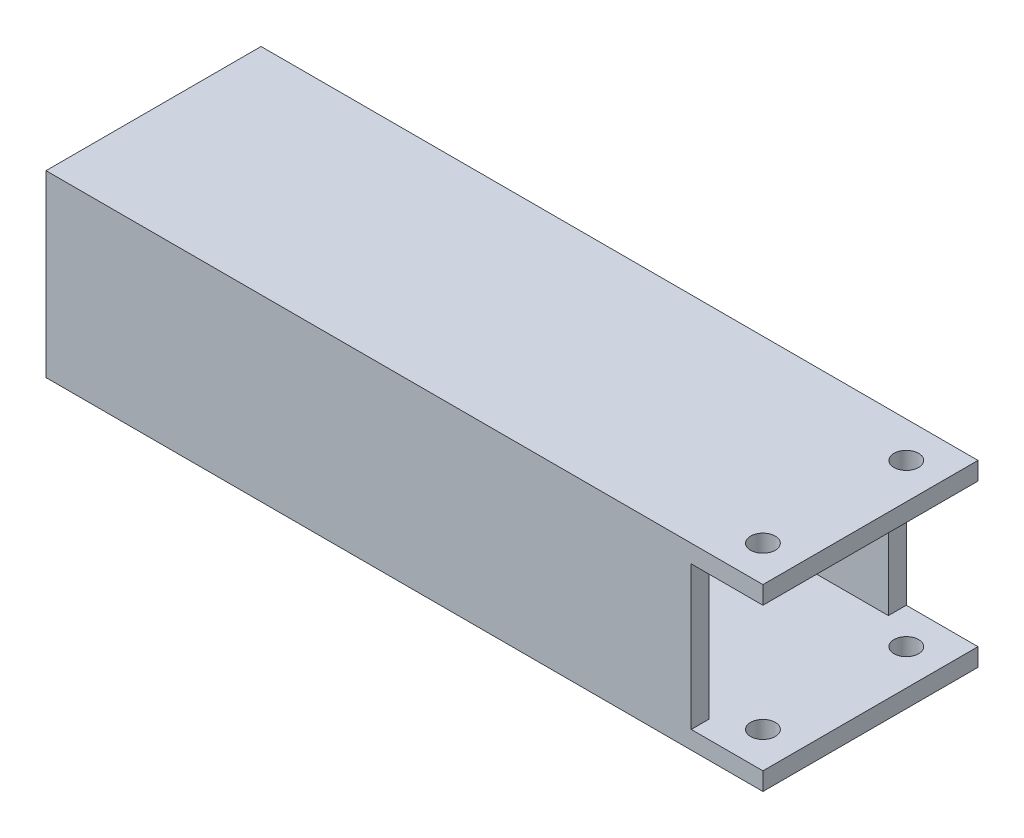
from build123d import *

# Parameters (mm, degrees)
SKETCH1_W           = 127
SKETCH1_H           = 38.1
BOSS_EXTRUDE4_DEPTH = 31.75
SKETCH6_R           = 2.1828125
CUT_EXTRUDE2_DEPTH  = 98.360900345
SKETCH8_W           = 12.7
SKETCH8_H           = 25.4
CUT_EXTRUDE4_DEPTH  = 101.327848513
SKETCH9_W           = 31.75
SKETCH9_H           = 25.4
CUT_EXTRUDE5_DEPTH  = 135.172054574


with BuildPart() as part:
    # Sketch1 → Boss-Extrude4 (new body)
    with BuildSketch(Plane(origin=(0, 0, 0), x_dir=(1, 0, 0), z_dir=(0, 1, 0))):
        with Locations((23.712411315, -10.362203736)):
            Rectangle(SKETCH1_W, SKETCH1_H)
    extrude(amount=BOSS_EXTRUDE4_DEPTH)

    # Sketch6 → Cut-Extrude2 (cut, through all)
    with BuildSketch(Plane(origin=(0, 31.75, 0), x_dir=(1, 0, 0), z_dir=(0, 1, 0))):
        with Locations((80.862411315, 2.337796264)):
            Circle(SKETCH6_R)
        with Locations((80.862411315, -23.062203736)):
            Circle(SKETCH6_R)
    extrude(amount=-CUT_EXTRUDE2_DEPTH, mode=Mode.SUBTRACT)

    # Sketch8 → Cut-Extrude4 (cut, through all)
    with BuildSketch(Plane.XY.offset(29.412203736)):
        with Locations((80.862411315, 15.875)):
            Rectangle(SKETCH8_W, SKETCH8_H)
    extrude(amount=-CUT_EXTRUDE4_DEPTH, mode=Mode.SUBTRACT)

    # Sketch9 → Cut-Extrude5 (cut, through all)
    with BuildSketch(Plane.ZY.offset(39.787588685)):
        with Locations((10.362203736, 15.875)):
            Rectangle(SKETCH9_W, SKETCH9_H)
    extrude(amount=-CUT_EXTRUDE5_DEPTH, mode=Mode.SUBTRACT)


solid = part.part
